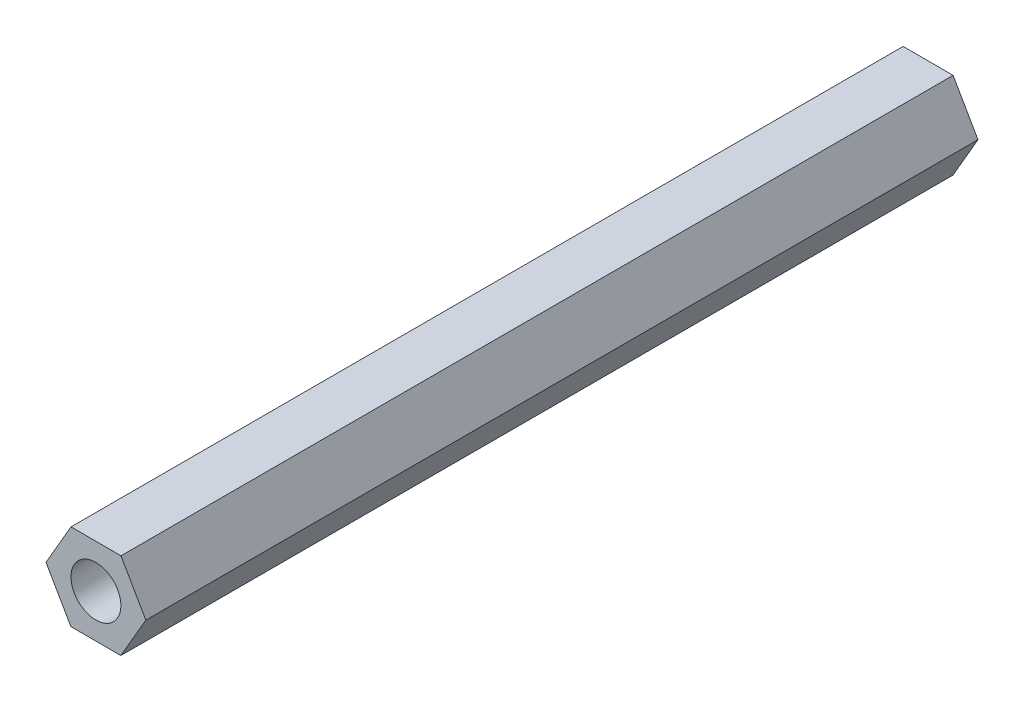
from build123d import *

# Parameters (mm, degrees)
SKETCH_1_W      = 1
SKETCH_1_H      = 50
SKETCH_5_R      = 1.5
EXTRUDE_4_DEPTH = 50


with BuildPart() as part:
    # 草图1 → 旋转1 (revolve)
    with BuildSketch(Plane.XZ):
        with Locations((2, 25)):
            Rectangle(SKETCH_1_W, SKETCH_1_H)
    revolve(axis=Axis((0, 0, 50), (0, 0, -1)))

    # 草图5 → 凸台-拉伸4 (add)
    with BuildSketch(Plane(origin=(0, 0, 0), x_dir=(-1, 0, 0), z_dir=(0, 0, -1))):
        Polygon((-1.504244122, 2.59562124), (-2.999995993, -0.004903003), (-1.495751872, -2.600524243), (1.504244122, -2.59562124), (2.999995993, 0.004903003), (1.495751872, 2.600524243), align=None)
        Circle(SKETCH_5_R, mode=Mode.SUBTRACT)
    extrude(amount=-EXTRUDE_4_DEPTH)


solid = part.part
